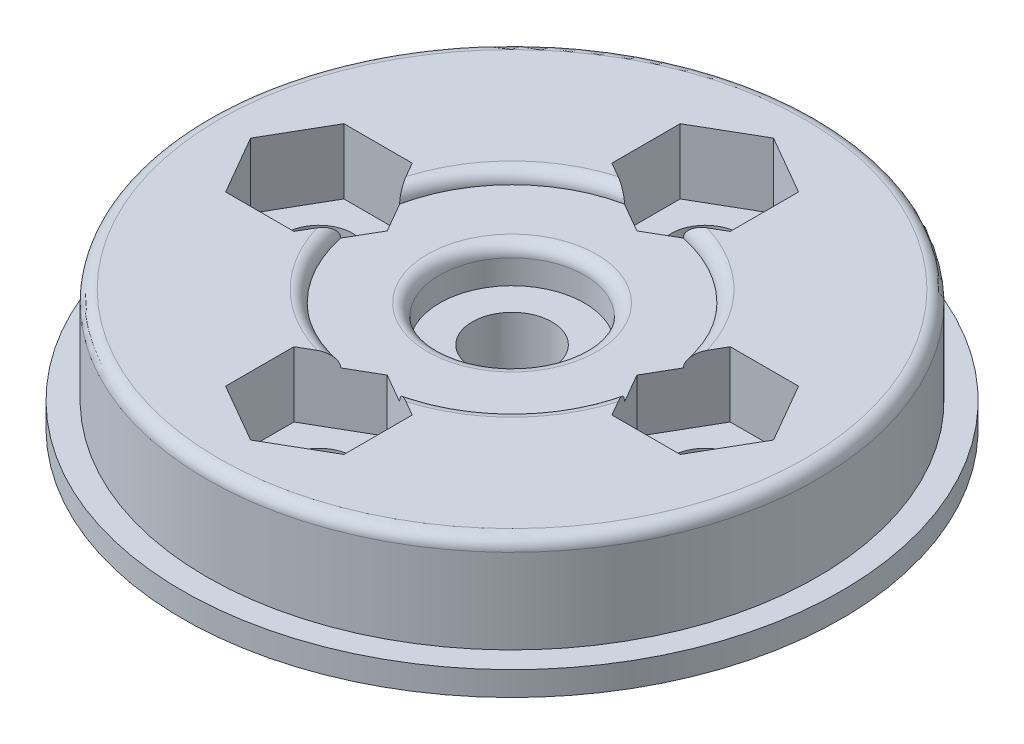
from build123d import *

# Parameters (mm, degrees)
SKETCH1_R           = 12.65
BOSS_EXTRUDE1_DEPTH = 4
SKETCH4_R           = 6
CUT_EXTRUDE3_DEPTH  = 0.5
SKETCH5_R           = 3
CUT_EXTRUDE4_DEPTH  = 1.5
FILLET1_R           = 0.5
FILLET2_R           = 0.5
FILLET3_R           = 0.5
SKETCH7_R           = 13.65
BOSS_EXTRUDE2_DEPTH = 1
SKETCH8_R           = 1.4
CUT_EXTRUDE6_DEPTH  = 20.941038087
CUT_EXTRUDE7_DEPTH  = 2.7
SKETCH16_R          = 1.65
CUT_EXTRUDE8_DEPTH  = 10


with BuildPart() as part:
    # Sketch1 → Boss-Extrude1 (new body)
    with BuildSketch(Plane(origin=(0, 0, 0), x_dir=(1, 0, 0), z_dir=(0, 1, 0))):
        with Locations(Location((0, 0, 0), (0, 0, 270))):
            Circle(SKETCH1_R)
    extrude(amount=BOSS_EXTRUDE1_DEPTH)

    # Sketch4 → Cut-Extrude3 (cut)
    with BuildSketch(Plane(origin=(0, 4, 0), x_dir=(1, 0, 0), z_dir=(0, 1, 0))):
        with Locations(Location((0, 0, 0), (0, 0, 270))):
            Circle(SKETCH4_R)
    extrude(amount=-CUT_EXTRUDE3_DEPTH, mode=Mode.SUBTRACT)

    # Sketch5 → Cut-Extrude4 (cut)
    with BuildSketch(Plane(origin=(0, 3.5, 0), x_dir=(1, 0, 0), z_dir=(0, 1, 0))):
        with Locations(Location((0, 0, 0), (0, 0, 270))):
            Circle(SKETCH5_R)
    extrude(amount=-CUT_EXTRUDE4_DEPTH, mode=Mode.SUBTRACT)

    # Fillet1
    fillet1_edges = [part.edges().sort_by_distance(p)[0] for p in [
        (0, 4, -6),
    ]]
    fillet(fillet1_edges, radius=FILLET1_R - 0.0001)  # a hair under: the kernel refuses the full size

    # Fillet2
    fillet2_edges = [part.edges().sort_by_distance(p)[0] for p in [
        (0, 3.5, -3),
    ]]
    fillet(fillet2_edges, radius=FILLET2_R)

    # Fillet3
    fillet3_edges = [part.edges().sort_by_distance(p)[0] for p in [
        (0, 4, -12.65),
    ]]
    fillet(fillet3_edges, radius=FILLET3_R)

    # Sketch7 → Boss-Extrude2 (add)
    with BuildSketch(Plane.XZ):
        with Locations(Location((0, 0, 0), (0, 0, 270))):
            Circle(SKETCH7_R)
    extrude(amount=BOSS_EXTRUDE2_DEPTH)

    # Sketch8 → Cut-Extrude6 (cut, through all)
    with BuildSketch(Plane(origin=(0, 4, 0), x_dir=(1, 0, 0), z_dir=(0, 1, 0))):
        with Locations(Location((0, 8, 0), (0, 0, 270))):
            Circle(SKETCH8_R)
        with Locations(Location((8, 0, 0), (0, 0, 270))):
            Circle(SKETCH8_R)
        with Locations(Location((0, -8, 0), (0, 0, 270))):
            Circle(SKETCH8_R)
        with Locations(Location((-8, 0, 0), (0, 0, 270))):
            Circle(SKETCH8_R)
    extrude(amount=-CUT_EXTRUDE6_DEPTH, mode=Mode.SUBTRACT)

    # Sketch15 → Cut-Extrude7 (cut)
    with BuildSketch(Plane(origin=(0, 4, 0), x_dir=(1, 0, 0), z_dir=(0, 1, 0))):
        Polygon((5.170983681, 0), (6.58549184, -2.45), (9.41450816, -2.45), (10.829016319, 0), (9.41450816, 2.45), (6.58549184, 2.45), align=None)
        Polygon((0, 5.170983681), (2.45, 6.58549184), (2.45, 9.41450816), (0, 10.829016319), (-2.45, 9.41450816), (-2.45, 6.58549184), align=None)
        Polygon((0, -5.170983681), (-2.45, -6.58549184), (-2.45, -9.41450816), (0, -10.829016319), (2.45, -9.41450816), (2.45, -6.58549184), align=None)
        Polygon((-5.170983681, 0), (-6.58549184, 2.45), (-9.41450816, 2.45), (-10.829016319, 0), (-9.41450816, -2.45), (-6.58549184, -2.45), align=None)
    extrude(amount=-CUT_EXTRUDE7_DEPTH, mode=Mode.SUBTRACT)

    # Sketch16 → Cut-Extrude8 (cut)
    with BuildSketch(Plane(origin=(0, 2, 0), x_dir=(1, 0, 0), z_dir=(0, 1, 0))):
        with Locations(Location((0, 0, 0), (0, 0, 270))):
            Circle(SKETCH16_R)
    extrude(amount=-CUT_EXTRUDE8_DEPTH, mode=Mode.SUBTRACT)


solid = part.part
